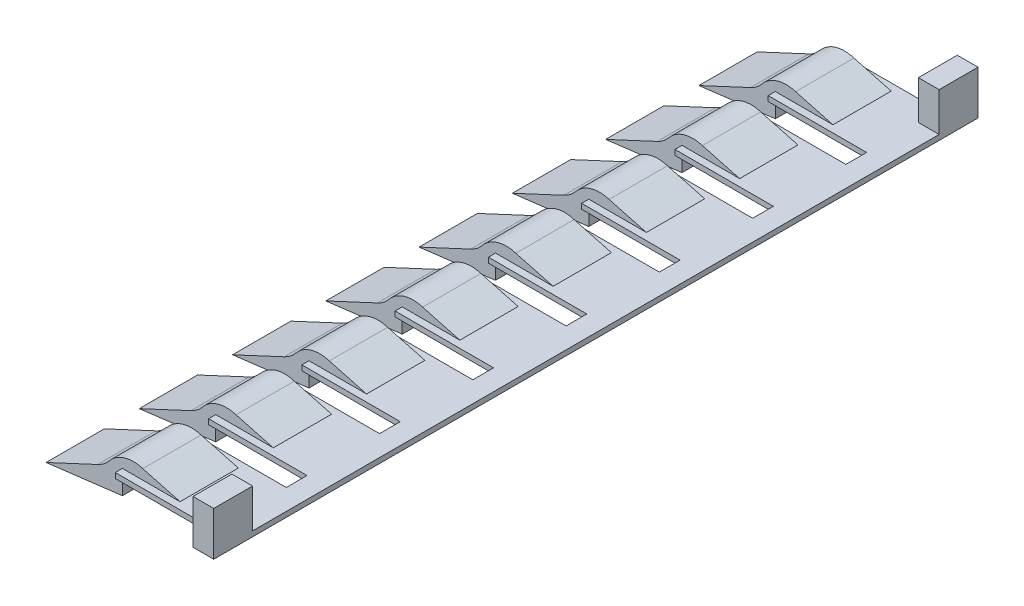
from build123d import *

# Parameters (mm, degrees)
EXTRUDE1_DEPTH       = 11.25
SKETCH3_W            = 22.5
SKETCH3_H            = 5.033767183
EXTRUDE2_DEPTH       = 10
EXTRUDE3_DEPTH       = 14
SKETCH5_W            = 10
SKETCH5_H            = 2
EXTRUDE4_DEPTH       = 167.995
LPATTERN1_OUTLINE_W  = 2
LPATTERN1_OUTLINE_H  = 28
LPATTERN1_DEPTH      = 36
EXTRUDE6_DEPTH       = 175.64601587
EXTRUDE6_DEPTH_BACK  = 175.64601587
SKETCH7_W            = 3
SKETCH7_H            = 2
EXTRUDE7_DEPTH       = 36
LPATTERN2_COUNT      = 4
LPATTERN2_PITCH      = 36
LPATTERN2_COUNT_DIR2 = 5
LPATTERN2_PITCH_DIR2 = 36
SKETCH8_W            = 2
SKETCH8_H            = 6.995
SKETCH8_H_2          = 8
EXTRUDE8_DEPTH       = 175.64601587
EXTRUDE9_DEPTH       = 175.64601587
SKETCH10_W           = 7.252078552
SKETCH10_H           = 8.610092753
EXTRUDE10_DEPTH      = 290.080499228
SKETCH11_W           = 8
SKETCH11_H           = 15
EXTRUDE11_DEPTH      = 15


# Read off the part's stored shape, not the designer's step: LPattern1
with BuildPart() as part:
    # Sketch1 → Extrude1 (new, symmetric)
    with BuildSketch(Plane.XY):
        with BuildLine():
            Line((22.243678564, 3.6), (7.8688831, 7.451714836))
            ThreePointArc((7.8688831, 7.451714836), (0.766318838, 7.515222423), (-5.127958891, 3.551897764))
            ThreePointArc((-5.127958891, 3.551897764), (-7.125613619, 1.593106665), (-9.522547255, 0.150124985))
            ThreePointArc((-9.522547255, 0.150124985), (-9.563578628, 0.131412483), (-9.604503865, 0.11246898))
            Line((-9.604503865, 0.11246898), (-29.497211353, -9.163652863))
            Line((-29.497211353, -9.163652863), (4.045876789, -5.033767183))
            Line((4.045876789, -5.033767183), (4.045876789, 0))
            Line((4.045876789, 0), (0, 0))
            Line((0, 0), (0, 3.6))
            Line((0, 3.6), (22.243678564, 3.6))
        make_face()
    extrude1 = extrude(amount=EXTRUDE1_DEPTH, both=True)

    # Sketch3 → Extrude2 (cut)
    with BuildSketch(Plane(origin=(4.045876789, 0, 0), x_dir=(0, 0, -1), z_dir=(1, 0, 0))):
        with Locations((0, -2.516883592)):
            Rectangle(SKETCH3_W, SKETCH3_H)
    extrude(amount=-EXTRUDE2_DEPTH, mode=Mode.SUBTRACT)

    # Sketch4 → Extrude3 (add, symmetric)
    with BuildSketch(Plane.XY):
        Polygon((0, 1.6), (0, 3.6), (22.243678564, 3.6), (36, 3.6), (36, 1.6), align=None)
    extrude(amount=EXTRUDE3_DEPTH, both=True)

    # Sketch5 → Extrude4 (add, symmetric)
    with BuildSketch(Plane.XY):
        with Locations((41, 2.6)):
            Rectangle(SKETCH5_W, SKETCH5_H)
    extrude(amount=EXTRUDE4_DEPTH, both=True)

    # LPattern1 outline → LPattern1 (add)
    with BuildSketch(Plane.YZ):
        with Locations((2.6, -144)):
            Rectangle(LPATTERN1_OUTLINE_W, LPATTERN1_OUTLINE_H)
        with Locations((2.6, -108)):
            Rectangle(LPATTERN1_OUTLINE_W, LPATTERN1_OUTLINE_H)
        with Locations((2.6, -72)):
            Rectangle(LPATTERN1_OUTLINE_W, LPATTERN1_OUTLINE_H)
        with Locations((2.6, -36)):
            Rectangle(LPATTERN1_OUTLINE_W, LPATTERN1_OUTLINE_H)
        with Locations((2.6, 36)):
            Rectangle(LPATTERN1_OUTLINE_W, LPATTERN1_OUTLINE_H)
        with Locations((2.6, 72)):
            Rectangle(LPATTERN1_OUTLINE_W, LPATTERN1_OUTLINE_H)
        with Locations((2.6, 108)):
            Rectangle(LPATTERN1_OUTLINE_W, LPATTERN1_OUTLINE_H)
        with Locations((2.6, 144)):
            Rectangle(LPATTERN1_OUTLINE_W, LPATTERN1_OUTLINE_H)
    extrude(amount=LPATTERN1_DEPTH)

    # Sketch6 → Extrude6 (cut, two sides: drawn at the far end of the back side and taken through both)
    with BuildSketch(Plane(origin=(0, 3.6, 0), x_dir=(1, 0, 0), z_dir=(0, 1, 0)).offset(-EXTRUDE6_DEPTH_BACK)):
        Polygon((-630.637797583, -133), (0, -133), (46, -133), (676.637797583, -133), (676.637797583, -1394.275595165), (-630.637797583, -1394.275595165), align=None)
    extrude(amount=EXTRUDE6_DEPTH + EXTRUDE6_DEPTH_BACK, mode=Mode.SUBTRACT)

    # Sketch7 → Extrude7 (add)
    with BuildSketch(Plane.ZY.offset(-36)):
        with Locations((-166.495, 2.6)):
            Rectangle(SKETCH7_W, SKETCH7_H)
    extrude(amount=EXTRUDE7_DEPTH)

    # LPattern2: Extrude1 4 × 5
    with Locations(*[Vector(0, 0, 1) * (i * LPATTERN2_PITCH) + Vector(0, 0, -1) * (j * LPATTERN2_PITCH_DIR2) for i in range(LPATTERN2_COUNT) for j in range(LPATTERN2_COUNT_DIR2) if (i, j) != (0, 0)]):
        add(extrude1)

    # Sketch8 → Extrude8 (cut, through all)
    with BuildSketch(Plane(origin=(0, 3.6, 0), x_dir=(1, 0, 0), z_dir=(0, 1, 0))):
        with Locations((37, 161.4975)):
            Rectangle(SKETCH8_W, SKETCH8_H)
        with Locations((37, 126)):
            Rectangle(SKETCH8_W, SKETCH8_H_2)
        with Locations((37, 90)):
            Rectangle(SKETCH8_W, SKETCH8_H_2)
        with Locations((37, 54)):
            Rectangle(SKETCH8_W, SKETCH8_H_2)
        with Locations((37, 18)):
            Rectangle(SKETCH8_W, SKETCH8_H_2)
        with Locations((37, -18)):
            Rectangle(SKETCH8_W, SKETCH8_H_2)
        with Locations((37, -54)):
            Rectangle(SKETCH8_W, SKETCH8_H_2)
        with Locations((37, -90)):
            Rectangle(SKETCH8_W, SKETCH8_H_2)
        with Locations((37, -126)):
            Rectangle(SKETCH8_W, SKETCH8_H_2)
    extrude(amount=-EXTRUDE8_DEPTH, mode=Mode.SUBTRACT)

    # Sketch9 → Extrude9 (cut, through all)
    with BuildSketch(Plane(origin=(0, 3.6, 0), x_dir=(1, 0, 0), z_dir=(0, 1, 0))):
        Polygon((38, 164.995), (46, 164.995), (46, 167.995), (0, 167.995), (0, 164.995), align=None)
        Polygon((38, -130), (46, -130), (46, -133), (0, -133), (0, -130), align=None)
    extrude(amount=-EXTRUDE9_DEPTH, mode=Mode.SUBTRACT)

    # Sketch10 → Extrude10 (cut, through all)
    with BuildSketch(Plane(origin=(0, 0, -155.25), x_dir=(-1, 0, 0), z_dir=(0, 0, -1))):
        with Locations((-3.626039276, -2.705046377)):
            Rectangle(SKETCH10_W, SKETCH10_H)
    extrude(amount=-EXTRUDE10_DEPTH, mode=Mode.SUBTRACT)

    # Sketch11 → Extrude11 (add)
    with BuildSketch(Plane(origin=(0, 3.6, 0), x_dir=(1, 0, 0), z_dir=(0, 1, 0))):
        with Locations((42, 157.495)):
            Rectangle(SKETCH11_W, SKETCH11_H)
        with Locations((42, -122.5)):
            Rectangle(SKETCH11_W, SKETCH11_H)
    extrude(amount=EXTRUDE11_DEPTH)


solid = part.part
